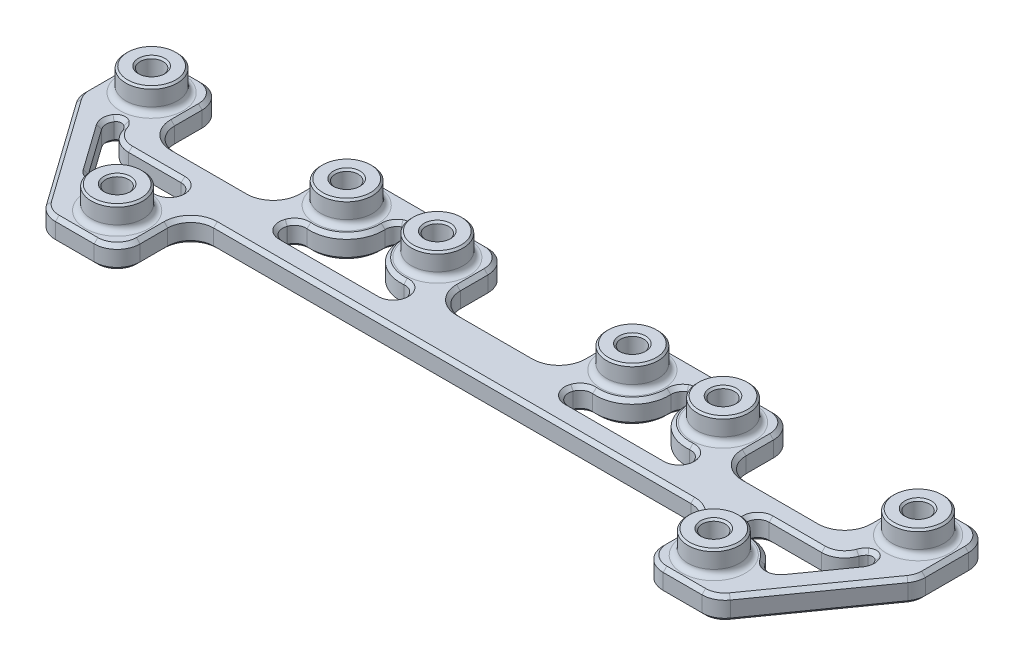
from build123d import *

# Parameters (mm, degrees)
BOSS_EXTRUDE2_DEPTH = 3.175
SKETCH2_R           = 3.571875
BOSS_EXTRUDE3_DEPTH = 3.175
CUT_EXTRUDE1_REACH  = 61.953
SKETCH3_R           = 1.5875
FILLET1_R           = 3.175
FILLET2_DEPTH       = 3.175
FILLET3_R           = 0.79375
CHAMFER1_SIZE       = 0.508
CHAMFER2_SIZE       = 0.254


with BuildPart() as part:
    # Sketch1 → Boss-Extrude2 (new body)
    with BuildSketch(Plane(origin=(0, 0, 0), x_dir=(1, 0, 0), z_dir=(0, 1, 0))):
        Polygon((-46.36135, -13.3477), (-58.1025, 3.175), (-58.1025, 13.335), (-47.9425, 13.335), (-47.9425, 3.175), (-31.115, 3.175), (-31.115, 13.335), (-8.41375, 13.335), (-8.41375, 3.175), (8.41375, 3.175), (8.41375, 13.335), (31.115, 13.335), (31.115, 3.175), (47.9425, 3.175), (47.9425, 13.335), (58.1025, 13.335), (58.1025, 3.175), (46.36135, -13.3477), (36.18865, -13.3477), (36.18865, -3.175), (-36.18865, -3.175), (-36.18865, -13.3477), align=None)
        with BuildLine():
            Line((-46.36135, -7.866483347), (-54.207507844, 3.175))
            Line((-54.207507844, 3.175), (-54.328921702, 3.345859308))
            ThreePointArc((-54.328921702, 3.345859308), (-52.694672058, 3.185588906), (-51.094676491, 3.555011009))
            ThreePointArc((-51.094676491, 3.555011009), (-50.318122019, 1.068570551), (-47.9425, 0))
            Line((-47.9425, 0), (-36.18865, 0))
            ThreePointArc((-36.18865, 0), (-38.565007855, -1.069400716), (-39.340560172, -3.557213642))
            ThreePointArc((-39.340560172, -3.557213642), (-43.948279576, -3.934164699), (-46.347481495, -7.885999761))
            Line((-46.347481495, -7.885999761), (-46.36135, -7.866483347))
        make_face(mode=Mode.SUBTRACT)
        with BuildLine():
            Line((36.18865, 0), (47.9425, 0))
            ThreePointArc((47.9425, 0), (50.318122019, 1.068570551), (51.094676491, 3.555011009))
            ThreePointArc((51.094676491, 3.555011009), (52.694672058, 3.185588906), (54.328921702, 3.345859308))
            Line((54.328921702, 3.345859308), (54.207507844, 3.175))
            Line((54.207507844, 3.175), (46.36135, -7.866483347))
            Line((46.36135, -7.866483347), (46.347481495, -7.885999761))
            ThreePointArc((46.347481495, -7.885999761), (43.948279576, -3.934164699), (39.340560172, -3.557213642))
            ThreePointArc((39.340560172, -3.557213642), (38.565007855, -1.069400716), (36.18865, 0))
        make_face(mode=Mode.SUBTRACT)
        with BuildLine():
            Line((-21.325713961, 10.16), (-18.203036039, 10.16))
            ThreePointArc((-18.203036039, 10.16), (-17.077128761, 4.654194999), (-11.565926491, 3.555011009))
            ThreePointArc((-11.565926491, 3.555011009), (-10.789372019, 1.068570551), (-8.41375, 0))
            Line((-8.41375, 0), (-31.115, 0))
            ThreePointArc((-31.115, 0), (-28.739377981, 1.068570551), (-27.962823509, 3.555011009))
            ThreePointArc((-27.962823509, 3.555011009), (-22.451621239, 4.654194999), (-21.325713961, 10.16))
        make_face(mode=Mode.SUBTRACT)
        with BuildLine():
            Line((18.203036039, 10.16), (21.325713961, 10.16))
            ThreePointArc((21.325713961, 10.16), (22.451621239, 4.654194999), (27.962823509, 3.555011009))
            ThreePointArc((27.962823509, 3.555011009), (28.739377981, 1.068570551), (31.115, 0))
            Line((31.115, 0), (8.41375, 0))
            ThreePointArc((8.41375, 0), (10.789372019, 1.068570551), (11.565926491, 3.555011009))
            ThreePointArc((11.565926491, 3.555011009), (17.077128761, 4.654194999), (18.203036039, 10.16))
        make_face(mode=Mode.SUBTRACT)
    extrude(amount=BOSS_EXTRUDE2_DEPTH)

    # Sketch2 → Boss-Extrude3 (add)
    with BuildSketch(Plane(origin=(0, 3.175, 0), x_dir=(1, 0, 0), z_dir=(0, 1, 0))):
        with Locations(Location((-53.0225, 8.255, 0), (0, 0, 270))):
            Circle(SKETCH2_R)
        with Locations(Location((-26.035, 8.255, 0), (0, 0, 270))):
            Circle(SKETCH2_R)
        with Locations(Location((-41.275, -8.26135, 0), (0, 0, 270))):
            Circle(SKETCH2_R)
        with Locations(Location((-13.49375, 8.255, 0), (0, 0, 270))):
            Circle(SKETCH2_R)
        with Locations(Location((13.49375, 8.255, 0), (0, 0, 270))):
            Circle(SKETCH2_R)
        with Locations(Location((26.035, 8.255, 0), (0, 0, 270))):
            Circle(SKETCH2_R)
        with Locations(Location((41.275, -8.26135, 0), (0, 0, 270))):
            Circle(SKETCH2_R)
        with Locations(Location((53.0225, 8.255, 0), (0, 0, 270))):
            Circle(SKETCH2_R)
    extrude(amount=BOSS_EXTRUDE3_DEPTH)

    # Sketch3 → Cut-Extrude1 (cut, up to next)
    with BuildSketch(Plane.XZ, mode=Mode.PRIVATE) as cut_extrude1_sk1:
        with Locations(Location((-53.0225, -8.255, 0), (0, 0, 270))):
            Circle(SKETCH3_R)
    cut_extrude1_tool1 = extrude(cut_extrude1_sk1.sketch, amount=-CUT_EXTRUDE1_REACH, mode=Mode.PRIVATE) & part.part
    # Sketch3 → Cut-Extrude1 (cut, up to next)
    with BuildSketch(Plane.XZ, mode=Mode.PRIVATE) as cut_extrude1_sk2:
        with Locations(Location((-41.275, 8.26135, 0), (0, 0, 270))):
            Circle(SKETCH3_R)
    cut_extrude1_tool2 = extrude(cut_extrude1_sk2.sketch, amount=-CUT_EXTRUDE1_REACH, mode=Mode.PRIVATE) & part.part
    # Sketch3 → Cut-Extrude1 (cut, up to next)
    with BuildSketch(Plane.XZ, mode=Mode.PRIVATE) as cut_extrude1_sk3:
        with Locations(Location((-26.035, -8.255, 0), (0, 0, 270))):
            Circle(SKETCH3_R)
    cut_extrude1_tool3 = extrude(cut_extrude1_sk3.sketch, amount=-CUT_EXTRUDE1_REACH, mode=Mode.PRIVATE) & part.part
    # Sketch3 → Cut-Extrude1 (cut, up to next)
    with BuildSketch(Plane.XZ, mode=Mode.PRIVATE) as cut_extrude1_sk4:
        with Locations(Location((-13.49375, -8.255, 0), (0, 0, 270))):
            Circle(SKETCH3_R)
    cut_extrude1_tool4 = extrude(cut_extrude1_sk4.sketch, amount=-CUT_EXTRUDE1_REACH, mode=Mode.PRIVATE) & part.part
    # Sketch3 → Cut-Extrude1 (cut, up to next)
    with BuildSketch(Plane.XZ, mode=Mode.PRIVATE) as cut_extrude1_sk5:
        with Locations(Location((13.49375, -8.255, 0), (0, 0, 270))):
            Circle(SKETCH3_R)
    cut_extrude1_tool5 = extrude(cut_extrude1_sk5.sketch, amount=-CUT_EXTRUDE1_REACH, mode=Mode.PRIVATE) & part.part
    # Sketch3 → Cut-Extrude1 (cut, up to next)
    with BuildSketch(Plane.XZ, mode=Mode.PRIVATE) as cut_extrude1_sk6:
        with Locations(Location((26.035, -8.255, 0), (0, 0, 270))):
            Circle(SKETCH3_R)
    cut_extrude1_tool6 = extrude(cut_extrude1_sk6.sketch, amount=-CUT_EXTRUDE1_REACH, mode=Mode.PRIVATE) & part.part
    # Sketch3 → Cut-Extrude1 (cut, up to next)
    with BuildSketch(Plane.XZ, mode=Mode.PRIVATE) as cut_extrude1_sk7:
        with Locations(Location((41.275, 8.26135, 0), (0, 0, 270))):
            Circle(SKETCH3_R)
    cut_extrude1_tool7 = extrude(cut_extrude1_sk7.sketch, amount=-CUT_EXTRUDE1_REACH, mode=Mode.PRIVATE) & part.part
    # Sketch3 → Cut-Extrude1 (cut, up to next)
    with BuildSketch(Plane.XZ, mode=Mode.PRIVATE) as cut_extrude1_sk8:
        with Locations(Location((53.0225, -8.255, 0), (0, 0, 270))):
            Circle(SKETCH3_R)
    cut_extrude1_tool8 = extrude(cut_extrude1_sk8.sketch, amount=-CUT_EXTRUDE1_REACH, mode=Mode.PRIVATE) & part.part
    add(cut_extrude1_tool1.solids().sort_by_distance((-53.0225, 0, -8.255))[0], mode=Mode.SUBTRACT)
    add(cut_extrude1_tool2.solids().sort_by_distance((-41.275, 0, 8.26135))[0], mode=Mode.SUBTRACT)
    add(cut_extrude1_tool3.solids().sort_by_distance((-26.035, 0, -8.255))[0], mode=Mode.SUBTRACT)
    add(cut_extrude1_tool4.solids().sort_by_distance((-13.49375, 0, -8.255))[0], mode=Mode.SUBTRACT)
    add(cut_extrude1_tool5.solids().sort_by_distance((13.49375, 0, -8.255))[0], mode=Mode.SUBTRACT)
    add(cut_extrude1_tool6.solids().sort_by_distance((26.035, 0, -8.255))[0], mode=Mode.SUBTRACT)
    add(cut_extrude1_tool7.solids().sort_by_distance((41.275, 0, 8.26135))[0], mode=Mode.SUBTRACT)
    add(cut_extrude1_tool8.solids().sort_by_distance((53.0225, 0, -8.255))[0], mode=Mode.SUBTRACT)

    # Fillet1
    fillet1_edges = [part.edges().sort_by_distance(p)[0] for p in [
        (-47.9425, 1.5875, -3.175),
        (-31.115, 1.5875, -3.175),
        (-31.115, 1.5875, -13.335),
        (-8.41375, 1.5875, -13.335),
        (-8.41375, 1.5875, -3.175),
        (8.41375, 1.5875, -3.175),
        (8.41375, 1.5875, -13.335),
        (31.115, 1.5875, -13.335),
        (31.115, 1.5875, -3.175),
        (47.9425, 1.5875, -3.175),
        (47.9425, 1.5875, -13.335),
        (58.1025, 1.5875, -13.335),
        (58.1025, 1.5875, -3.175),
        (46.36135, 1.5875, 13.3477),
        (36.18865, 1.5875, 13.3477),
        (36.18865, 1.5875, 3.175),
        (-36.18865, 1.5875, 3.175),
        (-36.18865, 1.5875, 13.3477),
        (-46.36135, 1.5875, 13.3477),
        (-58.1025, 1.5875, -3.175),
        (-58.1025, 1.5875, -13.335),
        (-47.9425, 1.5875, -13.335),
    ]]
    fillet(fillet1_edges, radius=FILLET1_R)

    # Fillet2: read off the stored shape, not the designer's step
    # Fillet2 outline → Fillet2 (add)
    with BuildSketch(Plane(origin=(0, 0, 0), x_dir=(1, 0, 0), z_dir=(0, 1, 0))):
        with BuildLine():
            Line((8.41375, 0), (12.903878061, 0))
            ThreePointArc((12.903878061, 0), (11.607689738, 0.670956448), (11.407168707, 2.116666667))
            ThreePointArc((11.407168707, 2.116666667), (10.246837105, 0.582623356), (8.41375, 0))
        make_face()
        with BuildLine():
            ThreePointArc((28.121581293, 2.116666667), (27.921060262, 0.670956448), (26.624871939, 0))
            Line((26.624871939, 0), (31.115, 0))
            ThreePointArc((31.115, 0), (29.281912895, 0.582623356), (28.121581293, 2.116666667))
        make_face()
        with BuildLine():
            ThreePointArc((11.565926491, 3.555011009), (11.570555029, 2.835578424), (11.413092723, 2.133573944))
            ThreePointArc((11.413092723, 2.133573944), (12.049856489, 2.945357344), (13.051094064, 3.194322602))
            ThreePointArc((13.051094064, 3.194322602), (12.294868341, 3.318494883), (11.565926491, 3.555011009))
        make_face()
        with BuildLine():
            ThreePointArc((26.477655936, 3.194322602), (27.478893511, 2.945357344), (28.115657277, 2.133573944))
            ThreePointArc((28.115657277, 2.133573944), (27.958194971, 2.835578424), (27.962823509, 3.555011009))
            ThreePointArc((27.962823509, 3.555011009), (27.233881659, 3.318494883), (26.477655936, 3.194322602))
        make_face()
        with BuildLine():
            ThreePointArc((18.203036039, 10.16), (18.455685375, 9.343851382), (18.567987094, 8.496904762))
            ThreePointArc((18.567987094, 8.496904762), (18.878180505, 9.517614547), (19.764375, 10.111523408))
            ThreePointArc((19.764375, 10.111523408), (20.650569495, 9.517614547), (20.960762906, 8.496904762))
            ThreePointArc((20.960762906, 8.496904762), (21.073064625, 9.343851382), (21.325713961, 10.16))
            Line((21.325713961, 10.16), (18.203036039, 10.16))
        make_face()
        with BuildLine():
            ThreePointArc((-8.41375, 0), (-10.246837105, 0.582623356), (-11.407168707, 2.116666667))
            ThreePointArc((-11.407168707, 2.116666667), (-11.607689738, 0.670956448), (-12.903878061, 0))
            Line((-12.903878061, 0), (-8.41375, 0))
        make_face()
        with BuildLine():
            ThreePointArc((-13.051094064, 3.194322602), (-12.049856489, 2.945357344), (-11.413092723, 2.133573944))
            ThreePointArc((-11.413092723, 2.133573944), (-11.570555029, 2.835578424), (-11.565926491, 3.555011009))
            ThreePointArc((-11.565926491, 3.555011009), (-12.294868341, 3.318494883), (-13.051094064, 3.194322602))
        make_face()
        with BuildLine():
            Line((-31.115, 0), (-26.624871939, 0))
            ThreePointArc((-26.624871939, 0), (-27.921060262, 0.670956448), (-28.121581293, 2.116666667))
            ThreePointArc((-28.121581293, 2.116666667), (-29.281912895, 0.582623356), (-31.115, 0))
        make_face()
        with BuildLine():
            ThreePointArc((-19.764375, 10.111523408), (-18.878180505, 9.517614547), (-18.567987094, 8.496904762))
            ThreePointArc((-18.567987094, 8.496904762), (-18.455685375, 9.343851382), (-18.203036039, 10.16))
            Line((-18.203036039, 10.16), (-21.325713961, 10.16))
            ThreePointArc((-21.325713961, 10.16), (-21.073064625, 9.343851382), (-20.960762906, 8.496904762))
            ThreePointArc((-20.960762906, 8.496904762), (-20.650569495, 9.517614547), (-19.764375, 10.111523408))
        make_face()
        with BuildLine():
            ThreePointArc((-27.962823509, 3.555011009), (-27.958194971, 2.835578424), (-28.115657277, 2.133573944))
            ThreePointArc((-28.115657277, 2.133573944), (-27.478893511, 2.945357344), (-26.477655936, 3.194322602))
            ThreePointArc((-26.477655936, 3.194322602), (-27.233881659, 3.318494883), (-27.962823509, 3.555011009))
        make_face()
        with BuildLine():
            Line((46.347481495, -7.885999761), (48.090874464, -5.432614956))
            ThreePointArc((48.090874464, -5.432614956), (46.779804313, -6.100462812), (45.483355687, -5.404656329))
            ThreePointArc((45.483355687, -5.404656329), (46.078410352, -6.588566298), (46.347481495, -7.885999761))
        make_face()
        with BuildLine():
            ThreePointArc((52.124457538, 3.168377356), (52.849392561, 2.132735371), (52.587968433, 0.895907763))
            Line((52.587968433, 0.895907763), (54.328921702, 3.345859308))
            ThreePointArc((54.328921702, 3.345859308), (52.694672057, 3.185588906), (51.094676491, 3.555011009))
            ThreePointArc((51.094676491, 3.555011009), (51.099305029, 2.835578424), (50.941842723, 2.133573944))
            ThreePointArc((50.941842723, 2.133573944), (51.39612918, 2.807568684), (52.124457538, 3.168377356))
        make_face()
        with BuildLine():
            ThreePointArc((39.340560172, -3.557213642), (40.070322708, -3.319719809), (40.827509925, -3.19472302))
            ThreePointArc((40.827509925, -3.19472302), (39.82542253, -2.946189972), (39.188112573, -2.133919179))
            ThreePointArc((39.188112573, -2.133919179), (39.345592895, -2.836863108), (39.340560172, -3.557213642))
        make_face()
        with BuildLine():
            ThreePointArc((36.18865, 0), (38.021737105, -0.582623356), (39.182068707, -2.116666667))
            ThreePointArc((39.182068707, -2.116666667), (39.382589738, -0.670956448), (40.678778061, 0))
            Line((40.678778061, 0), (36.18865, 0))
        make_face()
        with BuildLine():
            Line((-36.18865, 0), (-40.678778061, 0))
            ThreePointArc((-40.678778061, 0), (-39.382589738, -0.670956448), (-39.182068707, -2.116666667))
            ThreePointArc((-39.182068707, -2.116666667), (-38.021737105, -0.582623356), (-36.18865, 0))
        make_face()
        with BuildLine():
            ThreePointArc((-39.340560172, -3.557213642), (-39.345592895, -2.836863108), (-39.188112573, -2.133919179))
            ThreePointArc((-39.188112573, -2.133919179), (-39.82542253, -2.946189972), (-40.827509925, -3.19472302))
            ThreePointArc((-40.827509925, -3.19472302), (-40.070322708, -3.319719809), (-39.340560172, -3.557213642))
        make_face()
        with BuildLine():
            ThreePointArc((-52.124457538, 3.168377356), (-51.39612918, 2.807568684), (-50.941842723, 2.133573944))
            ThreePointArc((-50.941842723, 2.133573944), (-51.099305029, 2.835578424), (-51.094676491, 3.555011009))
            ThreePointArc((-51.094676491, 3.555011009), (-52.694672057, 3.185588906), (-54.328921702, 3.345859308))
            Line((-54.328921702, 3.345859308), (-52.587968433, 0.895907763))
            ThreePointArc((-52.587968433, 0.895907763), (-52.849392561, 2.132735371), (-52.124457538, 3.168377356))
        make_face()
        with BuildLine():
            ThreePointArc((-46.347481495, -7.885999761), (-46.078410352, -6.588566298), (-45.483355687, -5.404656329))
            ThreePointArc((-45.483355687, -5.404656329), (-46.779804313, -6.100462812), (-48.090874464, -5.432614956))
            Line((-48.090874464, -5.432614956), (-46.347481495, -7.885999761))
        make_face()
    extrude(amount=FILLET2_DEPTH)

    # Fillet3
    fillet3_edges = [part.edges().sort_by_distance(p)[0] for p in [
        (-53.0225, 3.175, -11.826875),
        (-26.035, 3.175, -11.826875),
        (-41.275, 3.175, 4.689475),
        (-13.49375, 3.175, -11.826875),
        (13.49375, 3.175, -11.826875),
        (26.035, 3.175, -11.826875),
        (41.275, 3.175, 4.689475),
        (53.0225, 3.175, -11.826875),
        (19.764375, 1.5875, -10.111523408),
        (-19.764375, 1.5875, -10.111523408),
        (52.124457538, 1.5875, -3.168377356),
        (-52.124457538, 1.5875, -3.168377356),
    ]]
    fillet(fillet3_edges, radius=FILLET3_R)

    # Chamfer1
    chamfer1_edges = [part.edges().sort_by_distance(p)[0] for p in [
        (-47.9425, 0, -8.255),
        (-47.9425, 3.175, -8.255),
        (-39.52875, 0, -3.175),
        (-39.52875, 3.175, -3.175),
        (-31.115, 0, -8.255),
        (-31.115, 3.175, -8.255),
        (-19.764375, 0, -13.335),
        (-8.41375, 0, -8.255),
        (0, 0, -3.175),
        (8.41375, 0, -8.255),
        (19.764375, 0, -13.335),
        (31.115, 0, -8.255),
        (39.52875, 0, -3.175),
        (47.9425, 0, -8.255),
        (53.0225, 0, -13.335),
        (58.1025, 0, -7.174103459),
        (52.413116814, 0, 4.831368335),
        (42.043092892, 0, 13.3477),
        (36.18865, 0, 8.26135),
        (0, 0, 3.175),
        (-36.18865, 0, 8.26135),
        (-42.043092892, 0, 13.3477),
        (-52.413116814, 0, 4.831368335),
        (-58.1025, 0, -7.174103459),
        (-53.0225, 0, -13.335),
        (-37.11858597, 0, 12.41776403),
        (-48.87243597, 0, -12.40506403),
        (-57.17256403, 0, -12.40506403),
        (-57.952218092, 0, -3.222958006),
        (-46.178800407, 0, 12.994032725),
        (37.11858597, 0, 12.41776403),
        (46.178800407, 0, 12.994032725),
        (57.952218092, 0, -3.222958006),
        (57.17256403, 0, -12.40506403),
        (48.87243597, 0, -12.40506403),
        (30.18506403, 0, -12.40506403),
        (9.34368597, 0, -12.40506403),
        (-9.34368597, 0, -12.40506403),
        (-30.18506403, 0, -12.40506403),
        (-19.764375, 3.175, -13.335),
        (-53.0225, 3.175, -13.335),
        (-58.1025, 3.175, -7.174103459),
        (-52.413116814, 3.175, 4.831368335),
        (-42.043092892, 3.175, 13.3477),
        (-36.18865, 3.175, 8.26135),
        (0, 3.175, 3.175),
        (36.18865, 3.175, 8.26135),
        (42.043092892, 3.175, 13.3477),
        (52.413116814, 3.175, 4.831368335),
        (58.1025, 3.175, -7.174103459),
        (53.0225, 3.175, -13.335),
        (47.9425, 3.175, -8.255),
        (39.52875, 3.175, -3.175),
        (31.115, 3.175, -8.255),
        (19.764375, 3.175, -13.335),
        (8.41375, 3.175, -8.255),
        (0, 3.175, -3.175),
        (-8.41375, 3.175, -8.255),
        (-37.11858597, 3.175, 12.41776403),
        (-48.87243597, 3.175, -12.40506403),
        (-57.17256403, 3.175, -12.40506403),
        (-57.952218092, 3.175, -3.222958006),
        (-46.178800407, 3.175, 12.994032725),
        (37.11858597, 3.175, 12.41776403),
        (46.178800407, 3.175, 12.994032725),
        (57.952218092, 3.175, -3.222958006),
        (57.17256403, 3.175, -12.40506403),
        (48.87243597, 3.175, -12.40506403),
        (30.18506403, 3.175, -12.40506403),
        (9.34368597, 3.175, -12.40506403),
        (-9.34368597, 3.175, -12.40506403),
        (-30.18506403, 3.175, -12.40506403),
        (-47.01256403, 0, -4.10493597),
        (-47.01256403, 3.175, -4.10493597),
        (-32.04493597, 0, -4.10493597),
        (-32.04493597, 3.175, -4.10493597),
        (-7.48381403, 0, -4.10493597),
        (-7.48381403, 3.175, -4.10493597),
        (7.48381403, 0, -4.10493597),
        (7.48381403, 3.175, -4.10493597),
        (32.04493597, 0, -4.10493597),
        (32.04493597, 3.175, -4.10493597),
        (47.01256403, 0, -4.10493597),
        (47.01256403, 3.175, -4.10493597),
        (35.25871403, 0, 4.10493597),
        (35.25871403, 3.175, 4.10493597),
        (-35.25871403, 0, 4.10493597),
        (-35.25871403, 3.175, 4.10493597),
        (11.41014264, 0, -2.125116127),
        (11.41014264, 3.175, -2.125116127),
        (19.764375, 0, 0),
        (19.764375, 3.175, 0),
        (28.11860736, 0, -2.125116127),
        (28.11860736, 3.175, -2.125116127),
        (22.51474001, 0, -4.592464047),
        (22.51474001, 3.175, -4.592464047),
        (17.01400999, 0, -4.592464047),
        (17.01400999, 3.175, -4.592464047),
        (-19.764375, 0, 0),
        (-19.764375, 3.175, 0),
        (-11.41014264, 0, -2.125116127),
        (-11.41014264, 3.175, -2.125116127),
        (-17.01400999, 0, -4.592464047),
        (-17.01400999, 3.175, -4.592464047),
        (-22.51474001, 0, -4.592464047),
        (-22.51474001, 3.175, -4.592464047),
        (-28.11860736, 0, -2.125116127),
        (-28.11860736, 3.175, -2.125116127),
        (43.456049941, 0, 3.666355171),
        (43.456049941, 3.175, 3.666355171),
        (50.339421449, 0, 2.268353597),
        (50.339421449, 3.175, 2.268353597),
        (49.782893609, 0, -0.58780531),
        (49.782893609, 3.175, -0.58780531),
        (39.185103057, 0, 2.125288573),
        (39.185103057, 3.175, 2.125288573),
        (-39.185103057, 0, 2.125288573),
        (-39.185103057, 3.175, 2.125288573),
        (-44.31063903, 0, 0),
        (-44.31063903, 3.175, 0),
        (-50.339421449, 0, 2.268353597),
        (-50.339421449, 3.175, 2.268353597),
        (-43.456049941, 0, 3.666355171),
        (-43.456049941, 3.175, 3.666355171),
        (11.607689738, 0, -0.670956448),
        (11.607689738, 3.175, -0.670956448),
        (27.921060262, 0, -0.670956448),
        (27.921060262, 3.175, -0.670956448),
        (27.478893511, 0, -2.945357344),
        (27.478893511, 3.175, -2.945357344),
        (20.764199955, 0, -9.340912019),
        (18.764550045, 3.175, -9.340912019),
        (12.049856489, 0, -2.945357344),
        (12.049856489, 3.175, -2.945357344),
        (-11.607689738, 0, -0.670956448),
        (-11.607689738, 3.175, -0.670956448),
        (-12.049856489, 0, -2.945357344),
        (-12.049856489, 3.175, -2.945357344),
        (-18.764550045, 0, -9.340912019),
        (-20.764199955, 3.175, -9.340912019),
        (-27.478893511, 0, -2.945357344),
        (-27.478893511, 3.175, -2.945357344),
        (46.779804313, 0, 6.100462812),
        (46.779804313, 3.175, 6.100462812),
        (52.880997913, 0, -1.778907949),
        (51.156640021, 3.175, -2.545199315),
        (39.382589738, 0, 0.670956448),
        (39.382589738, 3.175, 0.670956448),
        (39.82542253, 0, 2.946189972),
        (39.82542253, 3.175, 2.946189972),
        (-27.921060262, 0, -0.670956448),
        (-27.921060262, 3.175, -0.670956448),
        (-39.382589738, 0, 0.670956448),
        (-39.382589738, 3.175, 0.670956448),
        (-51.156640021, 0, -2.545199315),
        (-46.779804313, 0, 6.100462812),
        (-46.779804313, 3.175, 6.100462812),
        (-39.82542253, 0, 2.946189972),
        (-39.82542253, 3.175, 2.946189972),
        (-52.880997913, 3.175, -1.778907949),
        (-51.156640021, 3.175, -2.545199315),
        (52.880997913, 3.175, -1.778907949),
        (-18.764550045, 3.175, -9.340912019),
        (20.764199955, 3.175, -9.340912019),
        (51.156640021, 0, -2.545199315),
        (18.764550045, 0, -9.340912019),
        (-20.764199955, 0, -9.340912019),
        (-52.880997913, 0, -1.778907949),
        (52.099431744, 0, -3.026628188),
        (52.099431744, 3.175, -3.026628188),
        (19.764375, 0, -10.057969497),
        (19.764375, 3.175, -10.057969497),
        (-19.764375, 0, -10.057969497),
        (-19.764375, 3.175, -10.057969497),
        (-52.099431744, 0, -3.026628188),
        (-52.099431744, 3.175, -3.026628188),
        (-49.782893609, 0, -0.58780531),
        (-49.782893609, 3.175, -0.58780531),
        (44.310639031, 0, 0),
        (44.310639031, 3.175, 0),
    ]]
    chamfer(chamfer1_edges, length=CHAMFER1_SIZE)

    # Chamfer2
    chamfer2_edges = [part.edges().sort_by_distance(p)[0] for p in [
        (-53.0225, 6.35, -11.826875),
        (-26.035, 6.35, -11.826875),
        (-41.275, 6.35, 4.689475),
        (-13.49375, 6.35, -11.826875),
        (13.49375, 6.35, -11.826875),
        (26.035, 6.35, -11.826875),
        (41.275, 6.35, 4.689475),
        (53.0225, 6.35, -11.826875),
        (-53.0225, 6.35, -6.6675),
        (-53.0225, 0, -6.6675),
        (-41.275, 6.35, 9.84885),
        (-41.275, 0, 9.84885),
        (-26.035, 6.35, -6.6675),
        (-26.035, 0, -6.6675),
        (-13.49375, 6.35, -6.6675),
        (-13.49375, 0, -6.6675),
        (13.49375, 6.35, -6.6675),
        (13.49375, 0, -6.6675),
        (26.035, 6.35, -6.6675),
        (26.035, 0, -6.6675),
        (41.275, 6.35, 9.84885),
        (41.275, 0, 9.84885),
        (53.0225, 6.35, -6.6675),
        (53.0225, 0, -6.6675),
    ]]
    chamfer(chamfer2_edges, length=CHAMFER2_SIZE)


solid = part.part
